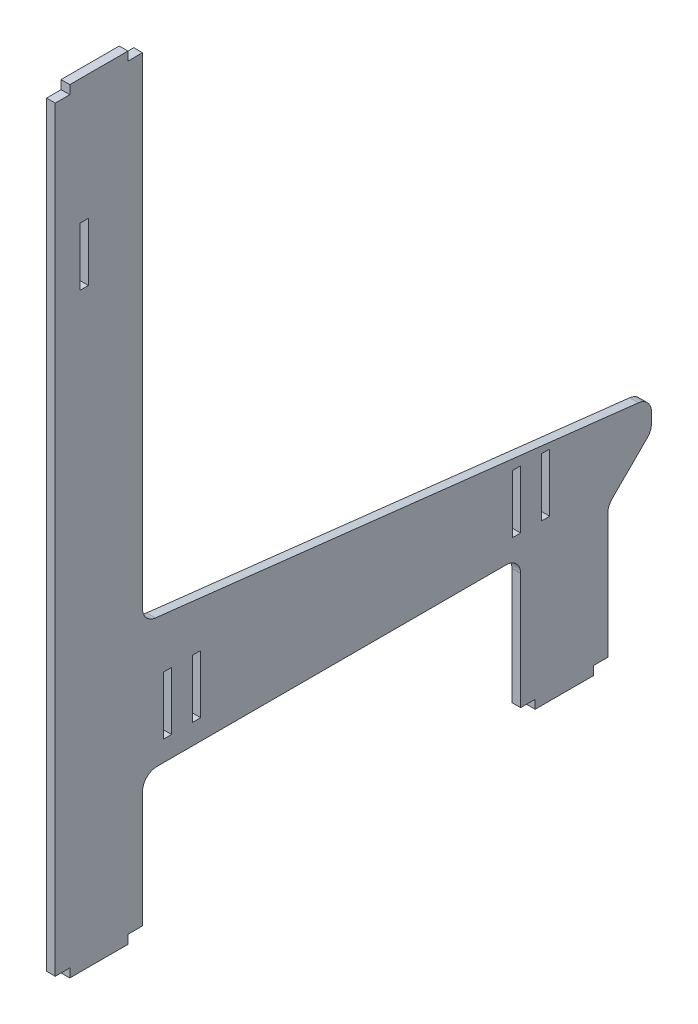
from build123d import *

# Parameters (mm, degrees)
BOSS_EXTRUDE1_START     = -3
BOSS_EXTRUDE1_OUTLINE_W = 2.8
BOSS_EXTRUDE1_OUTLINE_H = 20
BOSS_EXTRUDE1_DEPTH     = 3
SKETCH2_W               = 3
SKETCH2_H               = 20
BOSS_EXTRUDE2_DEPTH     = 3
SKETCH3_W               = 20
SKETCH3_H               = 3
BOSS_EXTRUDE3_DEPTH     = 3
FILLET1_R               = 5
FILLET2_R               = 5


with BuildPart() as part:
    # Boss-Extrude1: read off the stored shape, not the designer's step
    # Boss-Extrude1 outline → Boss-Extrude1 (new body)
    with BuildSketch(Plane(origin=(3, 0, 0), x_dir=(0, 0, -1), z_dir=(1, 0, 0)).offset(BOSS_EXTRUDE1_START)):
        Polygon((55, 65), (55, 75), (-120, 95), (-120, 265), (-150, 265), (-150, 5), (-120, 5), (-120, 50), (40, 50), align=None)
        with Locations((-111.4, 67)):
            Rectangle(BOSS_EXTRUDE1_OUTLINE_W, BOSS_EXTRUDE1_OUTLINE_H, mode=Mode.SUBTRACT)
        with Locations((-101.4, 67)):
            Rectangle(BOSS_EXTRUDE1_OUTLINE_W, BOSS_EXTRUDE1_OUTLINE_H, mode=Mode.SUBTRACT)
        with Locations((8.6, 67)):
            Rectangle(BOSS_EXTRUDE1_OUTLINE_W, BOSS_EXTRUDE1_OUTLINE_H, mode=Mode.SUBTRACT)
        with Locations((18.6, 67)):
            Rectangle(BOSS_EXTRUDE1_OUTLINE_W, BOSS_EXTRUDE1_OUTLINE_H, mode=Mode.SUBTRACT)
        with Locations((-140, 215)):
            Rectangle(BOSS_EXTRUDE1_OUTLINE_W, BOSS_EXTRUDE1_OUTLINE_H, mode=Mode.SUBTRACT)
    extrude(amount=BOSS_EXTRUDE1_DEPTH)

    # Sketch2 → Boss-Extrude2 (add)
    with BuildSketch(Plane(origin=(0, 265, 0), x_dir=(1, 0, 0), z_dir=(0, 1, 0))):
        with Locations((1.5, -135)):
            Rectangle(SKETCH2_W, SKETCH2_H)
    extrude(amount=BOSS_EXTRUDE2_DEPTH)

    # Sketch3 → Boss-Extrude3 (add)
    with BuildSketch(Plane(origin=(3, 0, 0), x_dir=(0, 0, -1), z_dir=(1, 0, 0))):
        with Locations((-135, 3.5)):
            Rectangle(SKETCH3_W, SKETCH3_H)
        Polygon((40, 50), (40, 5), (35, 5), (35, 2), (15, 2), (15, 5), (10, 5), (10, 50), align=None)
    extrude(amount=-BOSS_EXTRUDE3_DEPTH)

    # Fillet1
    fillet1_edges = [part.edges().sort_by_distance(p)[0] for p in [
        (1.5, 65, -55),
        (1.5, 50, -10),
        (1.5, 75, -55),
        (1.5, 50, -40),
        (1.5, 50, 120),
    ]]
    fillet(fillet1_edges, radius=FILLET1_R)

    # Fillet2
    fillet2_edges = [part.edges().sort_by_distance(p)[0] for p in [
        (1.5, 95, 120),
    ]]
    fillet(fillet2_edges, radius=FILLET2_R)


solid = part.part
